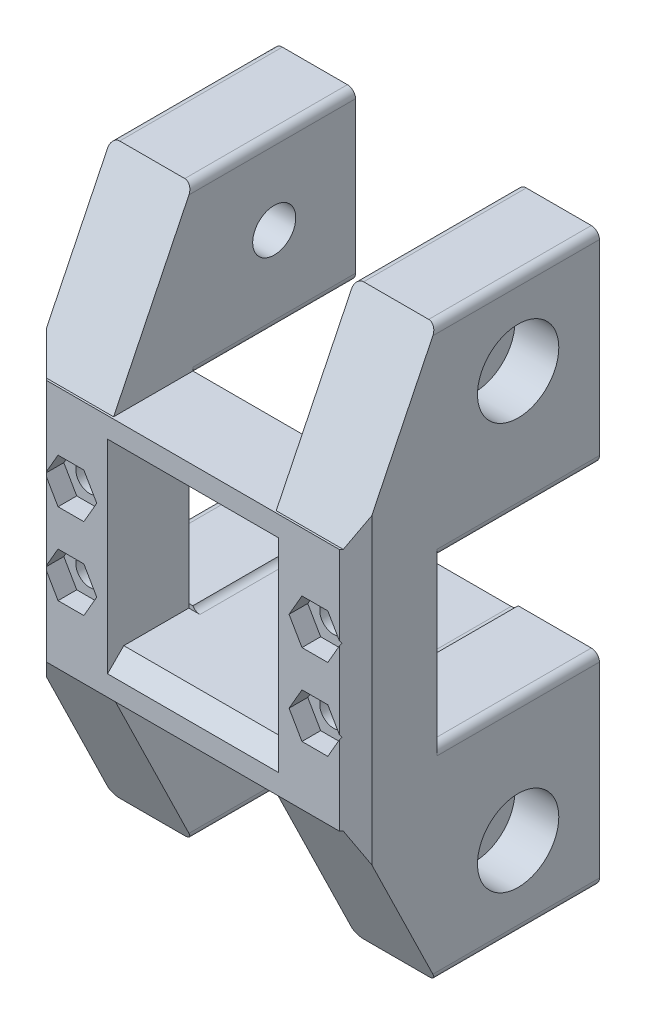
from build123d import *

# Parameters (mm, degrees)
MAIN_BODY_SKETCH_W                          = 21
MAIN_BODY_SKETCH_H                          = 21
MAIN_MOUNTING_FACE_DEPTH                    = 10
EXTRUSION_BOTTOM_MOUNTING_SKETCH_W          = 20
EXTRUSION_BOTTOM_MOUNTING_SKETCH_H          = 20
BOTTOM_EXTRUSION_MOUNTING_BLOCK_DEPTH       = 4.5
TENSION_BOLT_HOLES_M3_D                     = 3.4
NUT_TRAPS_M3_DEPTH                          = 2.3
TENSION_SLOT_BOTTOM_DEPTH                   = 45.161634934
MAIN_EXTRUSION_MOUNTS_SKETCH_W              = 10
MAIN_EXTRUSION_MOUNTS_SKETCH_H              = 25
MAIN_EXTRUSION_MOUNTS_DEPTH                 = 20
EXTRUSION_MOUNTING_BOLT_HOLES_R_D           = 5.3
EXTRUSION_MOUNTING_BOLT_HOLES_R_CBORE_D     = 10
EXTRUSION_MOUNTING_BOLT_HOLES_R_CBORE_DEPTH = 5.4
EXTRUSION_MOUNTING_BOLT_HOLES_L_D           = 5.3
EXTRUSION_MOUNTING_BOLT_HOLES_L_CBORE_D     = 10
EXTRUSION_MOUNTING_BOLT_HOLES_L_CBORE_DEPTH = 5.4
CLEARANCE_CHAMFERS_SIZE                     = 5
STENGTHENING_CHAMFERS_SIZE                  = 9.754651771
STENGTHENING_CHAMFERS_SIZE_2                = 20
COSMETIC_CHAMFERS_SIZE                      = 2
PRINT_HELPER_FILLETS_R                      = 1


with BuildPart() as part:
    # Main Body Sketch → Main Mounting Face (new body)
    with BuildSketch(Plane.XY):
        Polygon((-10, 30), (30, 30), (30, 25), (30, 15), (30, 0), (-10, 0), (-10, 15), (-10, 25), align=None)
        with Locations((10, 15)):
            Rectangle(MAIN_BODY_SKETCH_W, MAIN_BODY_SKETCH_H, mode=Mode.SUBTRACT)
    extrude(amount=MAIN_MOUNTING_FACE_DEPTH)

    # Extrusion Bottom Mounting Sketch → Bottom Extrusion Mounting Block (add)
    with BuildSketch(Plane(origin=(0, 0, 0), x_dir=(1, 0, 0), z_dir=(0, 1, 0))):
        with Locations((10, 10)):
            Rectangle(EXTRUSION_BOTTOM_MOUNTING_SKETCH_W, EXTRUSION_BOTTOM_MOUNTING_SKETCH_H)
    extrude(amount=BOTTOM_EXTRUSION_MOUNTING_BLOCK_DEPTH)

    # Tension Bolt Holes (M3) (through all)
    with Locations(Plane.XY.offset(10)):
        with Locations((-5, 20), (-5, 10), (25, 10), (25, 20)):
            Hole(TENSION_BOLT_HOLES_M3_D / 2)

    # Nut Trap Sketch → Nut Traps (M3) (cut)
    with BuildSketch(Plane.XY.offset(10)):
        Polygon((-3.41228676, 22.75), (-6.58771324, 22.75), (-8.175426481, 20), (-6.58771324, 17.25), (-3.41228676, 17.25), (-1.824573519, 20), align=None)
        Polygon((-1.824573519, 10), (-3.41228676, 7.25), (-6.58771324, 7.25), (-8.175426481, 10), (-6.58771324, 12.75), (-3.41228676, 12.75), align=None)
        Polygon((23.41228676, 7.25), (26.58771324, 7.25), (28.175426481, 10), (26.58771324, 12.75), (23.41228676, 12.75), (21.824573519, 10), align=None)
        Polygon((21.824573519, 20), (23.41228676, 22.75), (26.58771324, 22.75), (28.175426481, 20), (26.58771324, 17.25), (23.41228676, 17.25), align=None)
    extrude(amount=-NUT_TRAPS_M3_DEPTH, mode=Mode.SUBTRACT)

    # Tension Slot Sketch → Tension Slot - Bottom (cut, through all)
    with BuildSketch(Plane(origin=(0, 4.5, 0), x_dir=(1, 0, 0), z_dir=(0, 1, 0))):
        with BuildLine():
            Line((12.5, 10), (12.5, 5))
            ThreePointArc((12.5, 5), (10, 2.5), (7.5, 5))
            Line((7.5, 5), (7.5, 10))
            ThreePointArc((7.5, 10), (10, 12.5), (12.5, 10))
        make_face()
    extrude(amount=-TENSION_SLOT_BOTTOM_DEPTH, mode=Mode.SUBTRACT)

    # Main Extrusion Mounts Sketch → Main Extrusion Mounts (add)
    with BuildSketch(Plane.XY):
        with Locations((25, -7.5)):
            Rectangle(MAIN_EXTRUSION_MOUNTS_SKETCH_W, MAIN_EXTRUSION_MOUNTS_SKETCH_H)
        with Locations((-5, 37.5)):
            Rectangle(MAIN_EXTRUSION_MOUNTS_SKETCH_W, MAIN_EXTRUSION_MOUNTS_SKETCH_H)
        with Locations((25, 37.5)):
            Rectangle(MAIN_EXTRUSION_MOUNTS_SKETCH_W, MAIN_EXTRUSION_MOUNTS_SKETCH_H)
        with Locations((-5, -7.5)):
            Rectangle(MAIN_EXTRUSION_MOUNTS_SKETCH_W, MAIN_EXTRUSION_MOUNTS_SKETCH_H)
    extrude(amount=-MAIN_EXTRUSION_MOUNTS_DEPTH)

    # Extrusion Mounting Bolt Holes (R) (through all)
    with Locations(Plane.ZY.offset(10)):
        with Locations((-10, 40), (-10, -10)):
            CounterBoreHole(EXTRUSION_MOUNTING_BOLT_HOLES_R_D / 2, EXTRUSION_MOUNTING_BOLT_HOLES_R_CBORE_D / 2, EXTRUSION_MOUNTING_BOLT_HOLES_R_CBORE_DEPTH)

    # Extrusion Mounting Bolt Holes (L) (through all)
    with Locations(Plane(origin=(30, 0, 0), x_dir=(0, 0, -1), z_dir=(1, 0, 0))):
        with Locations((10, 40), (10, -10)):
            CounterBoreHole(EXTRUSION_MOUNTING_BOLT_HOLES_L_D / 2, EXTRUSION_MOUNTING_BOLT_HOLES_L_CBORE_D / 2, EXTRUSION_MOUNTING_BOLT_HOLES_L_CBORE_DEPTH)

    # Clearance Chamfers
    # the kernel refuses this chamfer: 5 mm, written as the material it takes off along each edge
    with BuildSketch(Plane(origin=(0, 25, 0), x_dir=(-1, 0, 0), z_dir=(0, 0, -1))) as clearance_chamfers_piece_1:
        Polygon((CLEARANCE_CHAMFERS_SIZE, 0), (0, CLEARANCE_CHAMFERS_SIZE), (0, 0), align=None)
    extrude(amount=32.85841494, mode=Mode.SUBTRACT)
    with BuildSketch(Plane(origin=(20, 25, 0), x_dir=(1, 0, 0), z_dir=(0, 0, -1))) as clearance_chamfers_piece_2:
        Polygon((CLEARANCE_CHAMFERS_SIZE, 0), (0, -CLEARANCE_CHAMFERS_SIZE), (0, 0), align=None)
    extrude(amount=32.85841494, mode=Mode.SUBTRACT)

    # Stengthening Chamfers
    # the kernel refuses this chamfer: 20, 9.754651771 mm, written as the material it adds along each edge
    with BuildSketch(Plane(origin=(-31.805007569, 30, 0), x_dir=(0, 0, 1), z_dir=(1, 0, 0))) as stengthening_chamfers_piece_1_section:
        Polygon((STENGTHENING_CHAMFERS_SIZE, 0), (0, -STENGTHENING_CHAMFERS_SIZE_2), (0, 0), align=None)
    stengthening_chamfers_piece_1 = extrude(amount=113.610015139, mode=Mode.PRIVATE)
    stengthening_chamfers_piece_1 = split(stengthening_chamfers_piece_1, bisect_by=Plane(origin=(0, 30, 0), z_dir=(-1, 0, 0)), keep=Keep.TOP, mode=Mode.PRIVATE)
    stengthening_chamfers_piece_1 = split(stengthening_chamfers_piece_1, bisect_by=Plane(origin=(-10, 30, 0), z_dir=(1, 0, 0)), keep=Keep.TOP, mode=Mode.PRIVATE)
    add(stengthening_chamfers_piece_1)
    with BuildSketch(Plane(origin=(20, 30, 0), x_dir=(0, 0, 1), z_dir=(1, 0, 0)), Plane(origin=(-10, 30, 0), x_dir=(0, 0, 1), z_dir=(1, 0, 0))) as stengthening_chamfers_piece_2:
        Polygon((STENGTHENING_CHAMFERS_SIZE, 0), (0, -STENGTHENING_CHAMFERS_SIZE_2), (0, 0), align=None)
    extrude(amount=10)
    with BuildSketch(Plane(origin=(-61.805007569, 30, 0), x_dir=(0, 0, 1), z_dir=(1, 0, 0))) as stengthening_chamfers_piece_3_section:
        Polygon((STENGTHENING_CHAMFERS_SIZE, 0), (0, -STENGTHENING_CHAMFERS_SIZE_2), (0, 0), align=None)
    stengthening_chamfers_piece_3 = extrude(amount=113.610015139, mode=Mode.PRIVATE)
    stengthening_chamfers_piece_3 = split(stengthening_chamfers_piece_3, bisect_by=Plane(origin=(20, 30, 0), z_dir=(1, 0, 0)), keep=Keep.TOP, mode=Mode.PRIVATE)
    stengthening_chamfers_piece_3 = split(stengthening_chamfers_piece_3, bisect_by=Plane(origin=(30, 30, 0), z_dir=(-1, 0, 0)), keep=Keep.TOP, mode=Mode.PRIVATE)
    add(stengthening_chamfers_piece_3)
    with BuildSketch(Plane(origin=(30, 0, 0), x_dir=(0, -1, 0), z_dir=(-1, 0, 0)), Plane(origin=(0, 0, 0), x_dir=(0, -1, 0), z_dir=(-1, 0, 0))) as stengthening_chamfers_piece_4:
        Polygon((STENGTHENING_CHAMFERS_SIZE_2, 0), (0, STENGTHENING_CHAMFERS_SIZE), (0, 0), align=None)
    extrude(amount=10)
    with BuildSketch(Plane(origin=(81.805007569, 0, 0), x_dir=(0, -1, 0), z_dir=(-1, 0, 0))) as stengthening_chamfers_piece_5_section:
        Polygon((STENGTHENING_CHAMFERS_SIZE_2, 0), (0, STENGTHENING_CHAMFERS_SIZE), (0, 0), align=None)
    stengthening_chamfers_piece_5 = extrude(amount=113.610015139, mode=Mode.PRIVATE)
    stengthening_chamfers_piece_5 = split(stengthening_chamfers_piece_5, bisect_by=Plane(origin=(0, 0, 0), z_dir=(-1, 0, 0)), keep=Keep.TOP, mode=Mode.PRIVATE)
    stengthening_chamfers_piece_5 = split(stengthening_chamfers_piece_5, bisect_by=Plane(origin=(-10, 0, 0), z_dir=(1, 0, 0)), keep=Keep.TOP, mode=Mode.PRIVATE)
    add(stengthening_chamfers_piece_5)
    with BuildSketch(Plane(origin=(51.805007569, 0, 0), x_dir=(0, -1, 0), z_dir=(-1, 0, 0))) as stengthening_chamfers_piece_6_section:
        Polygon((STENGTHENING_CHAMFERS_SIZE_2, 0), (0, STENGTHENING_CHAMFERS_SIZE), (0, 0), align=None)
    stengthening_chamfers_piece_6 = extrude(amount=113.610015139, mode=Mode.PRIVATE)
    stengthening_chamfers_piece_6 = split(stengthening_chamfers_piece_6, bisect_by=Plane(origin=(20, 0, 0), z_dir=(1, 0, 0)), keep=Keep.TOP, mode=Mode.PRIVATE)
    stengthening_chamfers_piece_6 = split(stengthening_chamfers_piece_6, bisect_by=Plane(origin=(30, 0, 0), z_dir=(-1, 0, 0)), keep=Keep.TOP, mode=Mode.PRIVATE)
    add(stengthening_chamfers_piece_6)

    # Cosmetic Chamfers
    # the kernel refuses this chamfer: 2 mm, written as the material it takes off along each edge
    with BuildSketch(Plane(origin=(30, 35.143365976, 10), x_dir=(-1, 0, 0), z_dir=(0, -1, 0))) as cosmetic_chamfers_piece_1:
        Polygon((COSMETIC_CHAMFERS_SIZE, 0), (0, COSMETIC_CHAMFERS_SIZE), (0, 0), align=None)
    extrude(amount=40.286731952, mode=Mode.SUBTRACT)
    with BuildSketch(Plane(origin=(-10, -5.143365976, 10), x_dir=(0, 0, -1), z_dir=(0, 1, 0))) as cosmetic_chamfers_piece_2:
        Polygon((COSMETIC_CHAMFERS_SIZE, 0), (0, -COSMETIC_CHAMFERS_SIZE), (0, 0), align=None)
    extrude(amount=40.286731952, mode=Mode.SUBTRACT)
    with BuildSketch(Plane(origin=(20.5, 25.5, 10), x_dir=(0, 1, 0), z_dir=(-1, 0, 0)), Plane(origin=(-0.5, 4.5, 10), x_dir=(0, -1, 0), z_dir=(1, 0, 0))) as cosmetic_chamfers_piece_3:
        Polygon((COSMETIC_CHAMFERS_SIZE, 0), (0, COSMETIC_CHAMFERS_SIZE), (0, 0), align=None)
    extrude(amount=21, mode=Mode.SUBTRACT)

    # Print Helper Fillets
    # the kernel refuses this fillet: 1 mm, written as the material it adds along each edge
    with BuildSketch(Plane(origin=(0, 4.5, -20), x_dir=(0, 1, 0), z_dir=(0, 0, 1))) as print_helper_fillets_piece_1:
        with BuildLine():
            CenterArc((1, -0.866025404), PRINT_HELPER_FILLETS_R, 120, 60)
            Line((0, -0.866025404), (0, 0))
            Line((0, 0), (0.5, 0))
        make_face()
    extrude(amount=20)
    with BuildSketch(Plane(origin=(20, 4.5, 0), x_dir=(-1, 0, 0), z_dir=(0, 0, -1))) as print_helper_fillets_piece_2:
        with BuildLine():
            CenterArc((0.866025404, 1), PRINT_HELPER_FILLETS_R, 210, 60)
            Line((0, 0.5), (0, 0))
            Line((0, 0), (0.866025404, 0))
        make_face()
    extrude(amount=20)
    # the kernel refuses this fillet: 1 mm, written as the material it takes off along each edge
    with BuildSketch(Plane(origin=(20, 50, 2.5), x_dir=(1, 0, 0), z_dir=(0, 0, -1)), Plane(origin=(30, -20, 2.5), x_dir=(-1, 0, 0), z_dir=(0, 0, -1)), Plane(origin=(0, 50, 2.5), x_dir=(0, -1, 0), z_dir=(0, 0, -1)), Plane(origin=(-10, 50, 2.5), x_dir=(1, 0, 0), z_dir=(0, 0, -1))) as print_helper_fillets_2_piece_1:
        with BuildLine():
            CenterArc((PRINT_HELPER_FILLETS_R, PRINT_HELPER_FILLETS_R), PRINT_HELPER_FILLETS_R, 180, 90)
            Line((0, PRINT_HELPER_FILLETS_R), (0, 0))
            Line((0, 0), (PRINT_HELPER_FILLETS_R, 0))
        make_face()
    extrude(amount=25, mode=Mode.SUBTRACT)
    with BuildSketch(Plane(origin=(30, 50, 2.5), x_dir=(-1, 0, 0), z_dir=(0, 0, -1)), Plane(origin=(20, -20, 2.5), x_dir=(1, 0, 0), z_dir=(0, 0, -1)), Plane(origin=(0, -20, 2.5), x_dir=(0, 1, 0), z_dir=(0, 0, -1)), Plane(origin=(-10, -20, 2.5), x_dir=(1, 0, 0), z_dir=(0, 0, -1))) as print_helper_fillets_2_piece_2:
        with BuildLine():
            CenterArc((PRINT_HELPER_FILLETS_R, -PRINT_HELPER_FILLETS_R), PRINT_HELPER_FILLETS_R, 90, 90)
            Line((0, -PRINT_HELPER_FILLETS_R), (0, 0))
            Line((0, 0), (PRINT_HELPER_FILLETS_R, 0))
        make_face()
    extrude(amount=25, mode=Mode.SUBTRACT)
    with BuildSketch(Plane(origin=(30, 25, 0), x_dir=(-1, 0, 0), z_dir=(0, 0, -1))) as print_helper_fillets_2_piece_3:
        with BuildLine():
            CenterArc((PRINT_HELPER_FILLETS_R, PRINT_HELPER_FILLETS_R), PRINT_HELPER_FILLETS_R, 180, 90)
            Line((0, PRINT_HELPER_FILLETS_R), (0, 0))
            Line((0, 0), (PRINT_HELPER_FILLETS_R, 0))
        make_face()
    extrude(amount=22.5, mode=Mode.SUBTRACT)
    with BuildSketch(Plane(origin=(30, 5, 0), x_dir=(-1, 0, 0), z_dir=(0, 0, -1)), Plane(origin=(-10, 5, 0), x_dir=(0, -1, 0), z_dir=(0, 0, -1)), Plane(origin=(-10, 25, 0), x_dir=(1, 0, 0), z_dir=(0, 0, -1))) as print_helper_fillets_2_piece_4:
        with BuildLine():
            CenterArc((PRINT_HELPER_FILLETS_R, -PRINT_HELPER_FILLETS_R), PRINT_HELPER_FILLETS_R, 90, 90)
            Line((0, -PRINT_HELPER_FILLETS_R), (0, 0))
            Line((0, 0), (PRINT_HELPER_FILLETS_R, 0))
        make_face()
    extrude(amount=22.5, mode=Mode.SUBTRACT)
    with BuildSketch(Plane(origin=(-5, 25, 0), x_dir=(0.7071067811865475, 0.7071067811865475, 0), z_dir=(0, 0, -1)), Plane(origin=(0, 30, 0), x_dir=(0, 1, 0), z_dir=(0, 0, -1)), Plane(origin=(25, 25, 0), x_dir=(1, 0, 0), z_dir=(0, 0, -1))) as print_helper_fillets_2_piece_5:
        with BuildLine():
            CenterArc((PRINT_HELPER_FILLETS_R * 0.414213562373, -PRINT_HELPER_FILLETS_R), PRINT_HELPER_FILLETS_R, 90, 45)
            Line((-PRINT_HELPER_FILLETS_R * 0.292893218813, -PRINT_HELPER_FILLETS_R * 0.292893218813), (0, 0))
            Line((0, 0), (PRINT_HELPER_FILLETS_R * 0.414213562373, 0))
        make_face()
    extrude(amount=21.035533906, mode=Mode.SUBTRACT)
    with BuildSketch(Plane(origin=(20, 30, 0), x_dir=(0, 1, 0), z_dir=(0, 0, -1))) as print_helper_fillets_2_piece_6:
        with BuildLine():
            CenterArc((PRINT_HELPER_FILLETS_R * 0.414213562373, PRINT_HELPER_FILLETS_R), PRINT_HELPER_FILLETS_R, 225, 45)
            Line((-PRINT_HELPER_FILLETS_R * 0.292893218813, PRINT_HELPER_FILLETS_R * 0.292893218813), (0, 0))
            Line((0, 0), (PRINT_HELPER_FILLETS_R * 0.414213562373, 0))
        make_face()
    extrude(amount=21.035533906, mode=Mode.SUBTRACT)


solid = part.part
